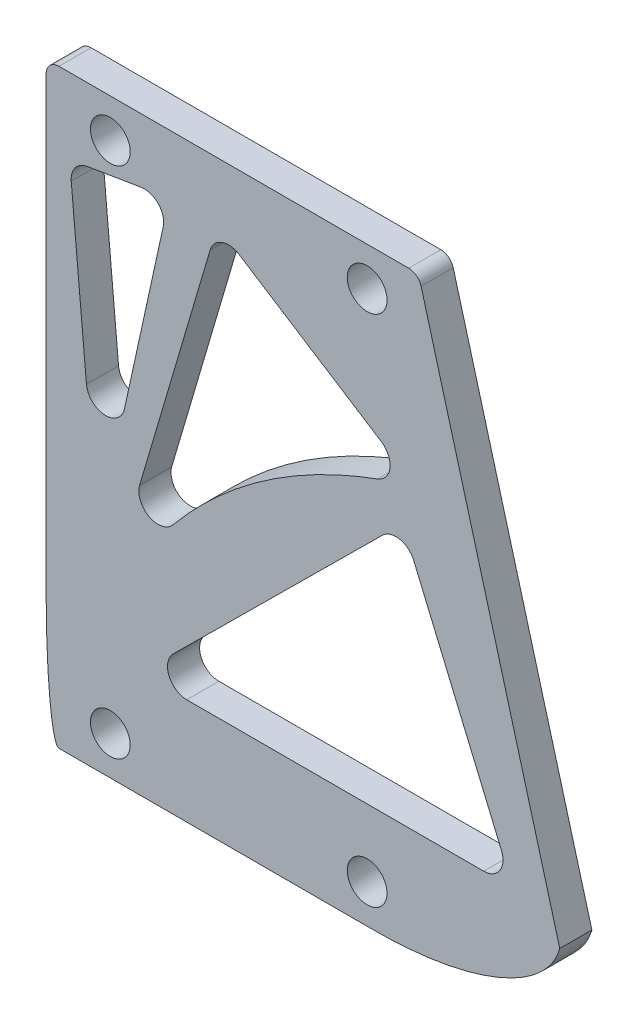
from build123d import *

# Parameters (mm, degrees)
SKETCH_1_R          = 1.55
EXTRUDE_1_DEPTH     = 2.5
CUT_EXTRUDE_1_DEPTH = 50.802108389
FILLET_1_R          = 1.5
FILLET_START        = -1
FILLET_2_DEPTH      = 4
FILLET_3_SIZE       = 10
FILLET_3_SIZE_2     = 1
FILLET_4_R          = 1


with BuildPart() as part:
    # 草图1 → 凸台-拉伸1 (new body)
    with BuildSketch(Plane.XY):
        Polygon((-15, 3), (-15, -3), (25, -3), (25, 3), (14, 43), (-15, 43), (-15, 37), align=None)
        with Locations((-10, 0)):
            Circle(SKETCH_1_R, mode=Mode.SUBTRACT)
        with Locations((10, 0)):
            Circle(SKETCH_1_R, mode=Mode.SUBTRACT)
        with Locations(Location((10, 40, 0), (0, 0, 180))):
            Circle(SKETCH_1_R, mode=Mode.SUBTRACT)
        with Locations(Location((-10, 40, 0), (0, 0, 180))):
            Circle(SKETCH_1_R, mode=Mode.SUBTRACT)
    extrude(amount=EXTRUDE_1_DEPTH)

    # 草图2 → 切除-拉伸1 (cut, through all)
    with BuildSketch(Plane.XY.offset(2.5)):
        with BuildLine():
            Line((-1.665681913, 38.399108294), (13.765828269, 28.537551491))
            add(Edge.make_bspline(
                [(-10.982655732, 6.815263357), (-3.769805813, 23.449653824), (13.765828269, 28.537551491)],
                knots=[0, 0, 0, 1, 1, 1], degree=2))
            Line((-10.982655732, 6.815263357), (-1.665681913, 38.399108294))
        make_face()
        Polygon((-13.170831516, 37.120758338), (-5.409421069, 38.399108294), (-10.982655732, 12.923419887), align=None)
        Polygon((-7.692188848, 5.253320152), (21.344617293, 5.253320152), (12.761410447, 25.524298024), align=None)
    extrude(amount=-CUT_EXTRUDE_1_DEPTH, mode=Mode.SUBTRACT)

    # 圆角1
    fillet_1_edges = [part.edges().sort_by_distance(p)[0] for p in [
        (13.765828269, 28.537551491, 1.25),
        (-10.982655732, 6.815263357, 1.25),
        (-1.665681913, 38.399108294, 1.25),
        (21.344617293, 5.253320152, 1.25),
        (-5.409421069, 38.399108294, 1.25),
        (-10.982655732, 12.923419887, 1.25),
        (-13.170831516, 37.120758338, 1.25),
        (-7.692188848, 5.253320152, 1.25),
        (12.761410447, 25.524298024, 1.25),
    ]]
    fillet(fillet_1_edges, radius=FILLET_1_R)

    # 圆角2: read off the stored shape, not the designer's step
    # 圆角2 outline → 圆角2 (cut)
    with BuildSketch(Plane.XY.offset(FILLET_START)):
        with BuildLine():
            Line((25, -3), (25, 3))
            add(Edge.make_bspline(
                [(25, 3), (23.339885287, -3), (10.543167705, -3)],
                knots=[0, 0, 0, 1, 1, 1], degree=2, weights=[1, 0.795822426, 1]))
            Line((10.543167705, -3), (25, -3))
        make_face()
    extrude(amount=FILLET_2_DEPTH, mode=Mode.SUBTRACT)

    # 圆角3
    # a fillet whose section is not a circle: 10, 1 mm, written as the material it takes off along each edge
    with BuildSketch(Plane(origin=(-15, -3, -25), x_dir=(0, 1, 0), z_dir=(0, 0, 1))) as fillet_3_piece_1:
        with BuildLine():
            Bezier((FILLET_3_SIZE, 0), (0, 0), (0, -FILLET_3_SIZE_2), weights=[1, 0.707106781, 1])
            Line((0, -FILLET_3_SIZE_2), (0, 0))
            Line((0, 0), (FILLET_3_SIZE, 0))
        make_face()
    extrude(amount=52.5, mode=Mode.SUBTRACT)

    # 圆角4
    fillet_4_edges = [part.edges().sort_by_distance(p)[0] for p in [
        (14, 43, 1.25),
        (-15, 43, 1.25),
    ]]
    fillet(fillet_4_edges, radius=FILLET_4_R)


solid = part.part
